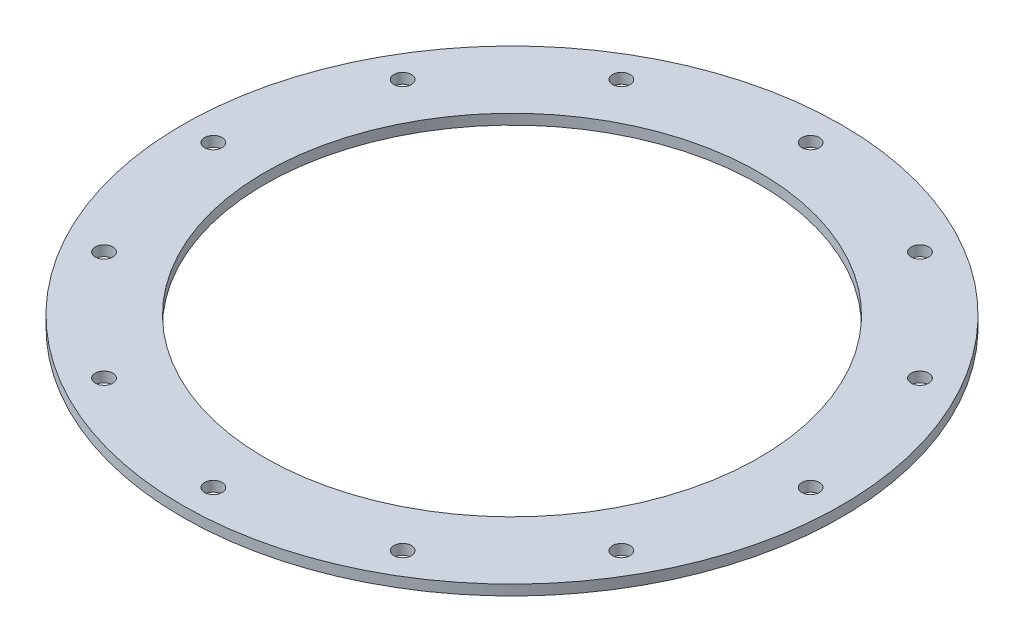
from build123d import *

# Parameters (mm, degrees)
SKETCH1_W                    = 12.7
SKETCH1_H                    = 1.5875
F_36_0_1065_DIAMETER_HOLE1_D = 2.7051
SCREW_PASSTHROUGHS_COUNT     = 12


with BuildPart() as part:
    # Sketch1 → Main (revolve)
    with BuildSketch(Plane.XY):
        with Locations((-44.45, 0.79375)):
            Rectangle(SKETCH1_W, SKETCH1_H)
    revolve(axis=Axis((0, 55, 0), (0, -1, 0)))

    # #36 (0.1065) Diameter Hole1 (through all)
    with Locations(Plane(origin=(0, 0, 0), x_dir=(-1, 0, 0), z_dir=(0, -1, 0))):
        with Locations((46.0375, 0)):
            f_36_0_1065_diameter_hole1 = Hole(F_36_0_1065_DIAMETER_HOLE1_D / 2)

    # Screw Passthroughs: #36 (0.1065) Diameter Hole1 ×12 about axis
    screw_passthroughs_axis = Axis((0, 55, 0), (0, -1, 0))
    for i in range(1, SCREW_PASSTHROUGHS_COUNT):
        add(f_36_0_1065_diameter_hole1.rotate(screw_passthroughs_axis, i * 360 / SCREW_PASSTHROUGHS_COUNT), mode=Mode.SUBTRACT)


solid = part.part
